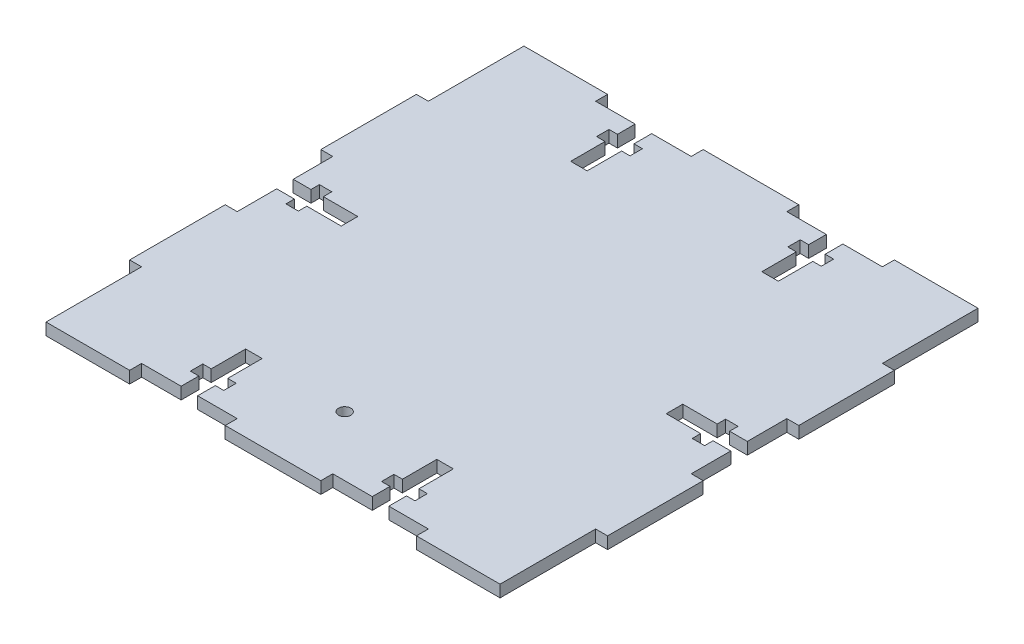
from build123d import *

# Parameters (mm, degrees)
SKETCH1_W                 = 127
SKETCH1_H                 = 127
BOSS_EXTRUDE1_DEPTH       = 3.175
SKETCH2_W                 = 3.175
SKETCH2_H                 = 25.4
CUT_EXTRUDE1_DEPTH        = 6.35
LPATTERN1_COUNT           = 3
LPATTERN1_PITCH           = 50.8
LPATTERN1_COUNT_DIR2      = 2
LPATTERN1_PITCH_DIR2      = 123.825
SKETCH3_W                 = 25.4
SKETCH3_H                 = 3.175
CUT_EXTRUDE2_DEPTH        = 6.35
LPATTERN2_COUNT           = 3
LPATTERN2_PITCH           = 50.8
LPATTERN2_COUNT_DIR2      = 2
LPATTERN2_PITCH_DIR2      = 123.825
SKETCH4_W                 = 17.145
SKETCH4_H                 = 4.3942
SKETCH4_W_2               = 3.302
SKETCH4_H_2               = 8.89
CUT_EXTRUDE3_DEPTH        = 8.89
SKETCH5_W                 = 4.3942
SKETCH5_H                 = 17.145
SKETCH5_W_2               = 8.89
SKETCH5_H_2               = 3.302
CUT_EXTRUDE4_DEPTH        = 30.48
LPATTERN3_COUNT           = 2
LPATTERN3_PITCH           = 50.8
MIRROR2_COPY_1_SKETCH_W   = 4.3942
MIRROR2_COPY_1_SKETCH_H   = 17.145
MIRROR2_COPY_1_SKETCH_W_2 = 8.89
MIRROR2_COPY_1_SKETCH_H_2 = 3.302
MIRROR2_COPY_1_DEPTH      = 30.48
MIRROR2_COPY_2_SKETCH_W   = 4.3942
MIRROR2_COPY_2_SKETCH_H   = 17.145
MIRROR2_COPY_2_SKETCH_W_2 = 8.89
MIRROR2_COPY_2_SKETCH_H_2 = 3.302
MIRROR2_COPY_2_DEPTH      = 30.48
F_4_CLEARANCE_HOLE4_D     = 3.2639
F_4_CLEARANCE_HOLE4_DEPTH = 10.16
F_4_CLEARANCE_HOLE4_TIP   = 0.980574487


with BuildPart() as part:
    # Sketch1 → Boss-Extrude1 (new body)
    with BuildSketch(Plane(origin=(0, 0, 0), x_dir=(1, 0, 0), z_dir=(0, 1, 0))):
        with Locations((63.5, 63.5)):
            Rectangle(SKETCH1_W, SKETCH1_H)
    extrude(amount=BOSS_EXTRUDE1_DEPTH)

    # Sketch2 → Cut-Extrude1 (cut)
    with BuildSketch(Plane(origin=(0, 3.175, 0), x_dir=(1, 0, 0), z_dir=(0, 1, 0))):
        with Locations((1.5875, 114.3)):
            Rectangle(SKETCH2_W, SKETCH2_H)
    cut_extrude1 = extrude(amount=-CUT_EXTRUDE1_DEPTH, mode=Mode.SUBTRACT)

    # LPattern1: Cut-Extrude1 3 × 2
    with Locations(*[(j * LPATTERN1_PITCH_DIR2, 0, i * LPATTERN1_PITCH) for i in range(LPATTERN1_COUNT) for j in range(LPATTERN1_COUNT_DIR2) if (i, j) != (0, 0)]):
        add(cut_extrude1, mode=Mode.SUBTRACT)

    # Sketch3 → Cut-Extrude2 (cut)
    with BuildSketch(Plane(origin=(0, 3.175, 0), x_dir=(1, 0, 0), z_dir=(0, 1, 0))):
        with Locations((38.1, 1.5875)):
            Rectangle(SKETCH3_W, SKETCH3_H)
    cut_extrude2 = extrude(amount=-CUT_EXTRUDE2_DEPTH, mode=Mode.SUBTRACT)

    # LPattern2: Cut-Extrude2 3 × 2
    with Locations(*[(i * LPATTERN2_PITCH, 0, -j * LPATTERN2_PITCH_DIR2) for i in range(LPATTERN2_COUNT) for j in range(LPATTERN2_COUNT_DIR2) if (i, j) != (0, 0)]):
        add(cut_extrude2, mode=Mode.SUBTRACT)

    # Sketch4 → Cut-Extrude3 (cut)
    with BuildSketch(Plane(origin=(0, 3.175, 0), x_dir=(1, 0, 0), z_dir=(0, 1, 0))):
        with Locations((115.2525, 63.5)):
            Rectangle(SKETCH4_W, SKETCH4_H)
        with Locations((117.475, 63.5)):
            Rectangle(SKETCH4_W_2, SKETCH4_H_2)
    cut_extrude3 = extrude(amount=-CUT_EXTRUDE3_DEPTH, mode=Mode.SUBTRACT)

    # Sketch5 → Cut-Extrude4 (cut)
    with BuildSketch(Plane(origin=(0, 3.175, 0), x_dir=(1, 0, 0), z_dir=(0, 1, 0))):
        with Locations((38.1, 11.7475)):
            Rectangle(SKETCH5_W, SKETCH5_H)
        with Locations((38.1, 9.525)):
            Rectangle(SKETCH5_W_2, SKETCH5_H_2)
    cut_extrude4 = extrude(amount=-CUT_EXTRUDE4_DEPTH, mode=Mode.SUBTRACT)

    # LPattern3: Cut-Extrude4 ×2
    with Locations(*[(i * LPATTERN3_PITCH, 0, 0) for i in range(1, LPATTERN3_COUNT)]):
        add(cut_extrude4, mode=Mode.SUBTRACT)

    # Mirror2 copy 1 sketch → Mirror2 copy 1 (cut)
    with BuildSketch(Plane(origin=(50.8, 3.175, -127), x_dir=(1, 0, 0), z_dir=(0, 1, 0))):
        with Locations((38.1, -11.7475)):
            Rectangle(MIRROR2_COPY_1_SKETCH_W, MIRROR2_COPY_1_SKETCH_H)
        with Locations((38.1, -9.525)):
            Rectangle(MIRROR2_COPY_1_SKETCH_W_2, MIRROR2_COPY_1_SKETCH_H_2)
    extrude(amount=-MIRROR2_COPY_1_DEPTH, mode=Mode.SUBTRACT)

    # Mirror2 copy 2 sketch → Mirror2 copy 2 (cut)
    with BuildSketch(Plane(origin=(0, 3.175, -127), x_dir=(1, 0, 0), z_dir=(0, 1, 0))):
        with Locations((38.1, -11.7475)):
            Rectangle(MIRROR2_COPY_2_SKETCH_W, MIRROR2_COPY_2_SKETCH_H)
        with Locations((38.1, -9.525)):
            Rectangle(MIRROR2_COPY_2_SKETCH_W_2, MIRROR2_COPY_2_SKETCH_H_2)
    extrude(amount=-MIRROR2_COPY_2_DEPTH, mode=Mode.SUBTRACT)

    # #4 Clearance Hole4
    with Locations(Plane(origin=(0, 3.175, 0), x_dir=(1, 0, 0), z_dir=(0, 1, 0))):
        with Locations((63.5, 19.05)):
            Hole(F_4_CLEARANCE_HOLE4_D / 2, depth=F_4_CLEARANCE_HOLE4_DEPTH)
            with Locations((0, 0, -(F_4_CLEARANCE_HOLE4_DEPTH + F_4_CLEARANCE_HOLE4_TIP / 2))):  # 118° drill point
                Cone(0, F_4_CLEARANCE_HOLE4_D / 2, F_4_CLEARANCE_HOLE4_TIP, mode=Mode.SUBTRACT)

    # Mirror3: Cut-Extrude3 across plane
    add(cut_extrude3.mirror(Plane.ZY.offset(-63.5)), mode=Mode.SUBTRACT)


solid = part.part
